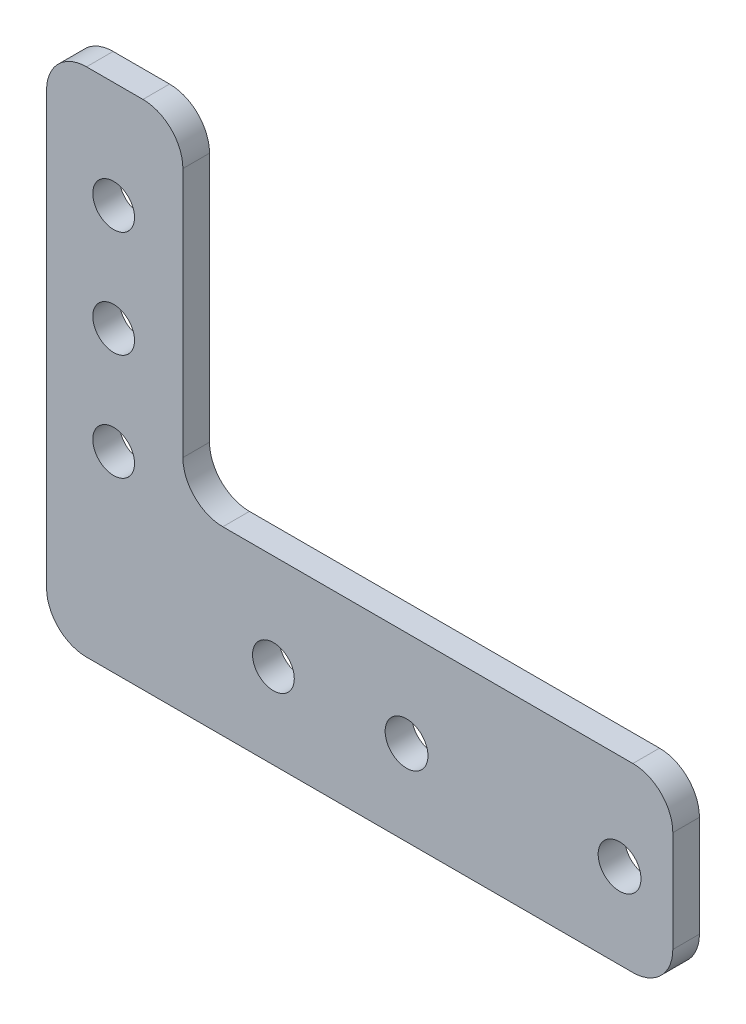
from build123d import *

# Parameters (mm, degrees)
SKETCH1_R           = 2.4892
SKETCH1_R_2         = 2.5527
BOSS_EXTRUDE1_DEPTH = 3.175
FILLET1_R           = 4.7625


with BuildPart() as part:
    # Sketch1 → Boss-Extrude1 (new body)
    with BuildSketch(Plane.XY):
        Polygon((-33.401, 31.75), (-33.401, -29.21), (41.275, -29.21), (41.275, -7.62), (-17.145, -7.62), (-17.145, 31.75), align=None)
        with Locations((-6.35, -19.05)):
            Circle(SKETCH1_R, mode=Mode.SUBTRACT)
        with Locations((-25.4, -6.35)):
            Circle(SKETCH1_R, mode=Mode.SUBTRACT)
        with Locations((9.525, -19.05)):
            Circle(SKETCH1_R_2, mode=Mode.SUBTRACT)
        with Locations((34.925, -19.05)):
            Circle(SKETCH1_R_2, mode=Mode.SUBTRACT)
        with Locations((-25.4, 6.35)):
            Circle(SKETCH1_R, mode=Mode.SUBTRACT)
        with Locations((-25.4, 19.05)):
            Circle(SKETCH1_R, mode=Mode.SUBTRACT)
    extrude(amount=BOSS_EXTRUDE1_DEPTH)

    # Fillet1
    fillet1_edges = [part.edges().sort_by_distance(p)[0] for p in [
        (-33.401, 31.75, 1.5875),
        (-17.145, 31.75, 1.5875),
        (-17.145, -7.62, 1.5875),
        (41.275, -7.62, 1.5875),
        (41.275, -29.21, 1.5875),
        (-33.401, -29.21, 1.5875),
    ]]
    fillet(fillet1_edges, radius=FILLET1_R)


solid = part.part
